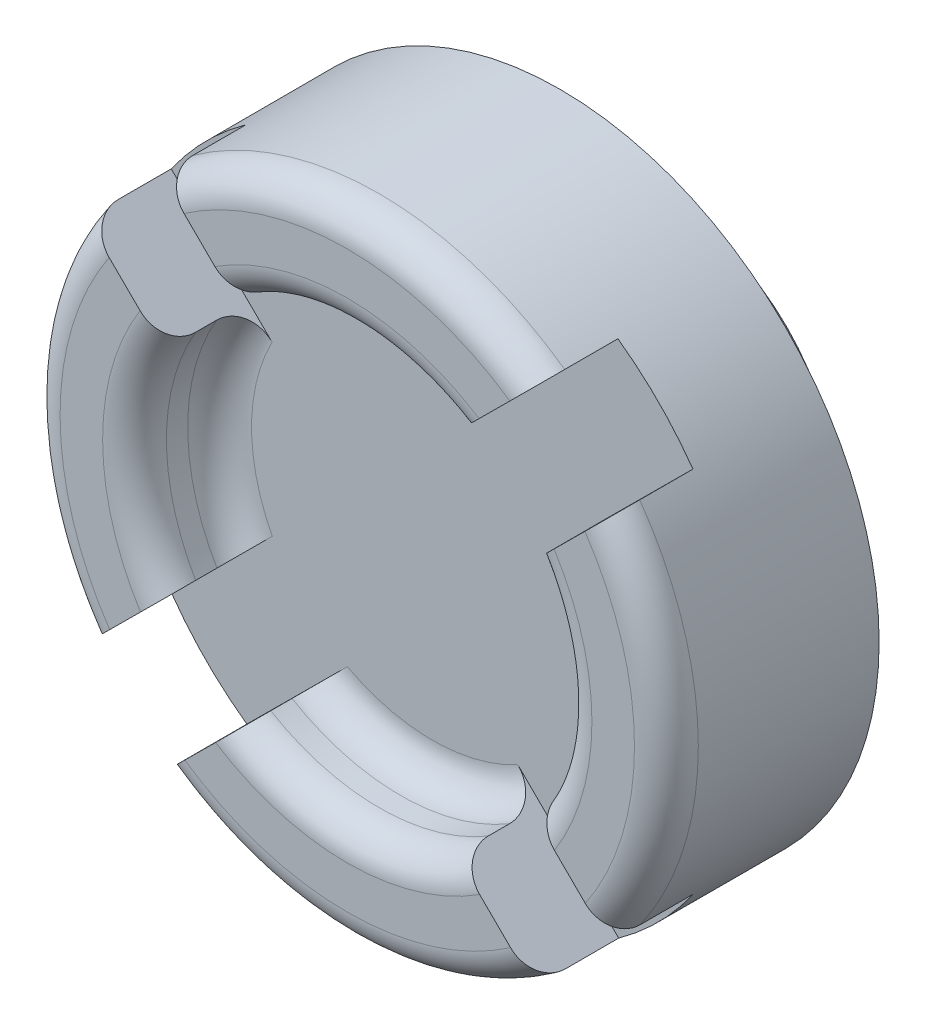
from build123d import *

# Parameters (mm, degrees)
SKETCH_1_R          = 1.599999994
EXTRUDE_1_DEPTH     = 2
SKETCH_2_R          = 3
EXTRUDE_2_DEPTH     = 1
SKETCH_3_R          = 3
SKETCH_3_R_2        = 1.599999994
EXTRUDE_3_DEPTH     = 1
CUT_EXTRUDE_1_DEPTH = 0.8
SKETCH_5_R          = 2
CUT_EXTRUDE_2_DEPTH = 0.8
FILLET_1_R          = 0.3
FILLET_2_R          = 0.3
CHAMFER_2_SIZE      = 1
EXTRUDE_4_DEPTH     = 0.5


# Some blends are built 0.0001 mm under size
with BuildPart() as part:
    # 草图1 → 凸台-拉伸1 (new body)
    with BuildSketch(Plane.XY):
        Circle(SKETCH_1_R)
        Polygon((1.484924235, 0), (0, 1.484924235), (-1.484924235, 0), (0, -1.484924235), align=None, mode=Mode.SUBTRACT)
    extrude(amount=-EXTRUDE_1_DEPTH)

    # 草图2 → 凸台-拉伸2 (add)
    with BuildSketch(Plane.XY):
        Circle(SKETCH_2_R)
    extrude(amount=EXTRUDE_2_DEPTH)

    # 草图3 → 凸台-拉伸3 (add)
    with BuildSketch(Plane(origin=(0, 0, 0), x_dir=(-1, 0, 0), z_dir=(0, 0, -1))):
        Circle(SKETCH_3_R)
        with Locations(Location((0, 0, 0), (0, 0, 180))):
            Circle(SKETCH_3_R_2, mode=Mode.SUBTRACT)
    extrude(amount=EXTRUDE_3_DEPTH)

    # 草图4 → 切除-拉伸1 (cut)
    with BuildSketch(Plane.XY.offset(1)):
        Polygon((2.840154811, -2.105592708), (2.13698266, -2.816612347), (0.001071679, -0.704275308), (-2.12840084, -2.823102879), (-2.833733613, -2.114226528), (-0.709971025, -0.001080346), (-2.840154811, 2.105592708), (-2.13698266, 2.816612347), (-0.001071679, 0.704275308), (2.12840084, 2.823102879), (2.833733613, 2.114226528), (0.709971025, 0.001080346), align=None)
    extrude(amount=-CUT_EXTRUDE_1_DEPTH, mode=Mode.SUBTRACT)

    # 草图5 → 切除-拉伸2 (cut)
    with BuildSketch(Plane.XY.offset(1)):
        Circle(SKETCH_5_R)
    extrude(amount=-CUT_EXTRUDE_2_DEPTH, mode=Mode.SUBTRACT)

    # 圆角1
    fillet_1_edges = [part.edges().sort_by_distance(p)[0] for p in [
        (1.930129409, 0.524023343, 1),
        (0.003043349, -1.999997685, 1),
        (-1.999997685, -0.003043349, 1),
        (-0.003043349, 1.999997685, 1),
        (-0.004565023, 2.999996527, 1),
        (-2.999996527, -0.004565023, 1),
        (0.004565023, -2.999996527, 1),
        (2.859077887, 0.908665855, 1),
    ]]
    fillet(fillet_1_edges, radius=FILLET_1_R)

    # 圆角2
    # the kernel refuses this fillet: 0.3 mm, written as the material it adds along each edge
    with BuildSketch(Plane(origin=(0, 0, 0.2), x_dir=(0.7896841124236736, 0.613513653137104, 0), z_dir=(0.613513653137104, -0.7896841124236736, 0))) as fillet_2_piece_1_section:
        with BuildLine():
            CenterArc((2 - FILLET_2_R, FILLET_2_R), FILLET_2_R, 270, 90)
            Line((2 - FILLET_2_R, 0), (2, 0))
            Line((2, 0), (2, FILLET_2_R))
        make_face()
    fillet_2_piece_1 = revolve(axis=Axis((0, 0, 0.2), (0, 0, 1)), revolution_arc=104.486373309, mode=Mode.PRIVATE)
    fillet_2_piece_1 = split(fillet_2_piece_1, bisect_by=Plane(origin=(0.603196481, 1.305522812, 0.285319886), z_dir=(-0.7053327724211024, 0.7088763503945956, 0)), keep=Keep.TOP, mode=Mode.PRIVATE)
    fillet_2_piece_1 = split(fillet_2_piece_1, bisect_by=Plane(origin=(-0.607166844, 1.303681031, 0.285319886), z_dir=(0.7031721506430704, 0.711019638659861, 0)), keep=Keep.TOP, mode=Mode.PRIVATE)
    add(fillet_2_piece_1)
    with BuildSketch(Plane(origin=(0, 0, 0.2), x_dir=(1, 0, 0), z_dir=(0, -1, 0))) as fillet_2_piece_2_section:
        with BuildLine():
            CenterArc((2 - FILLET_2_R, FILLET_2_R), FILLET_2_R, 270, 90)
            Line((2 - FILLET_2_R, 0), (2, 0))
            Line((2, 0), (2, FILLET_2_R))
        make_face()
    fillet_2_piece_2 = revolve(axis=Axis((0, 0, 0.2), (0, 0, 1)), revolution_arc=51.865822775, mode=Mode.PRIVATE)
    fillet_2_piece_2 = split(fillet_2_piece_2, bisect_by=Plane(origin=(1.528365858, 0.815384132, 0.269855635), z_dir=(0.7053327724211024, -0.7088763503945955, 0)), keep=Keep.TOP, mode=Mode.PRIVATE)
    add(fillet_2_piece_2)
    with BuildSketch(Plane(origin=(0, 0, 0.2), x_dir=(-0.7896841124236732, -0.6135136531371046, 0), z_dir=(-0.6135136531371046, 0.7896841124236732, 0))) as fillet_2_piece_3_section:
        with BuildLine():
            CenterArc((2 - FILLET_2_R, FILLET_2_R), FILLET_2_R, 270, 90)
            Line((2 - FILLET_2_R, 0), (2, 0))
            Line((2, 0), (2, FILLET_2_R))
        make_face()
    fillet_2_piece_3 = revolve(axis=Axis((0, 0, 0.2), (0, 0, 1)), revolution_arc=104.486373309, mode=Mode.PRIVATE)
    fillet_2_piece_3 = split(fillet_2_piece_3, bisect_by=Plane(origin=(0.607166844, -1.303681031, 0.285319886), z_dir=(-0.7031721506430706, -0.7110196386598608, 0)), keep=Keep.TOP, mode=Mode.PRIVATE)
    fillet_2_piece_3 = split(fillet_2_piece_3, bisect_by=Plane(origin=(-0.603196481, -1.305522812, 0.285319886), z_dir=(0.7053327724211026, -0.7088763503945954, 0)), keep=Keep.TOP, mode=Mode.PRIVATE)
    add(fillet_2_piece_3)
    with BuildSketch(Plane(origin=(0, 0, 0.2), x_dir=(-0.6198560202042671, 0.784715562619047, 0), z_dir=(0.784715562619047, 0.6198560202042671, 0))) as fillet_2_piece_4_section:
        with BuildLine():
            CenterArc((2 - FILLET_2_R, FILLET_2_R), FILLET_2_R, 270, 90)
            Line((2 - FILLET_2_R, 0), (2, 0))
            Line((2, 0), (2, FILLET_2_R))
        make_face()
    fillet_2_piece_4 = revolve(axis=Axis((0, 0, 0.2), (0, 0, 1)), revolution_arc=103.563128964, mode=Mode.PRIVATE)
    fillet_2_piece_4 = split(fillet_2_piece_4, bisect_by=Plane(origin=(-1.316253088, -0.604331686, 0.285332918), z_dir=(-0.7053327724211024, 0.7088763503945957, 0)), keep=Keep.TOP, mode=Mode.PRIVATE)
    fillet_2_piece_4 = split(fillet_2_piece_4, bisect_by=Plane(origin=(-1.318086183, 0.600323075, 0.285332918), z_dir=(-0.7031721506430707, -0.7110196386598606, 0)), keep=Keep.TOP, mode=Mode.PRIVATE)
    add(fillet_2_piece_4)
    with BuildSketch(Plane(origin=(0, 0, 0.2), x_dir=(0.6198962648649622, -0.7846837712139004, 0), z_dir=(-0.7846837712139004, -0.6198962648649622, 0))) as fillet_2_piece_5_section:
        with BuildLine():
            CenterArc((2 - FILLET_2_R, FILLET_2_R), FILLET_2_R, 270, 90)
            Line((2 - FILLET_2_R, 0), (2, 0))
            Line((2, 0), (2, FILLET_2_R))
        make_face()
    fillet_2_piece_5 = revolve(axis=Axis((0, 0, 0.2), (0, 0, 1)), revolution_arc=51.69144042, mode=Mode.PRIVATE)
    fillet_2_piece_5 = split(fillet_2_piece_5, bisect_by=Plane(origin=(1.532032043, -0.811907626, 0.269859578), z_dir=(0.7031721506430706, 0.7110196386598608, 0)), keep=Keep.TOP, mode=Mode.PRIVATE)
    add(fillet_2_piece_5)

    # 倒角2
    chamfer_2_edges = [part.edges().sort_by_distance(p)[0] for p in [
        (-1.599999994, 0, -1),
    ]]
    chamfer(chamfer_2_edges, length=CHAMFER_2_SIZE - 0.0001)  # a hair under: the kernel refuses the full size

    # 草图6 → 凸台-拉伸4 (add)
    with BuildSketch(Plane(origin=(0, 0, 0), x_dir=(-1, 0, 0), z_dir=(0, 0, -1))):
        Polygon((0, 1.484924235), (1.484924235, 0), (0, -1.484924235), (-1.484924235, 0), align=None)
    extrude(amount=EXTRUDE_4_DEPTH)


solid = part.part
